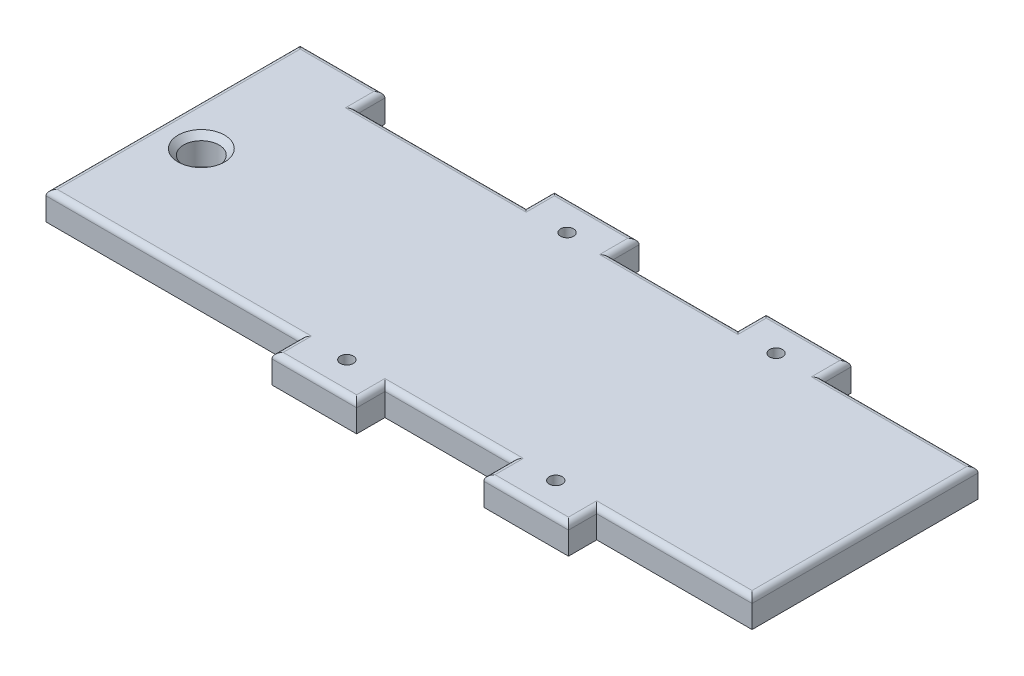
from build123d import *

# Parameters (mm, degrees)
SKETCH1_W           = 260
SKETCH1_H           = 100
BOSS_EXTRUDE1_DEPTH = 10
SKETCH3_W           = 55
SKETCH3_H           = 10
SKETCH3_W_2         = 60
SKETCH3_W_3         = 45
CUT_EXTRUDE2_DEPTH  = 140.642400438
FILLET1_R           = 2
SKETCH2_R           = 6.25
CUT_EXTRUDE1_DEPTH  = 140.642400438
CHAMFER1_SIZE       = 2
SKETCH4_R           = 2.3
CUT_EXTRUDE3_DEPTH  = 6.2


with BuildPart() as part:
    # Sketch1 → Boss-Extrude1 (new body)
    with BuildSketch(Plane(origin=(0, 0, 0), x_dir=(1, 0, 0), z_dir=(0, 1, 0))):
        Rectangle(SKETCH1_W, SKETCH1_H)
    extrude(amount=BOSS_EXTRUDE1_DEPTH)

    # Sketch3 → Cut-Extrude2 (cut, through all)
    with BuildSketch(Plane(origin=(0, 10, 0), x_dir=(1, 0, 0), z_dir=(0, 1, 0))):
        with Locations((102.5, 45)):
            Rectangle(SKETCH3_W, SKETCH3_H)
        with Locations((102.5, -45)):
            Rectangle(SKETCH3_W, SKETCH3_H)
        Polygon((-130, -50), (-30, -50), (-30, -40), (-120, -40), (-120, 50), (-130, 50), (-130, -40), align=None)
        with Locations((-60, 45)):
            Rectangle(SKETCH3_W_2, SKETCH3_H)
        with Locations((22.5, 45)):
            Rectangle(SKETCH3_W_3, SKETCH3_H)
        with Locations((22.5, -45)):
            Rectangle(SKETCH3_W_3, SKETCH3_H)
    extrude(amount=-CUT_EXTRUDE2_DEPTH, mode=Mode.SUBTRACT)

    # Fillet1
    fillet1_edges = [part.edges().sort_by_distance(p)[0] for p in [
        (130, 10, 0),
        (-60, 10, -40),
        (-30, 10, -45),
        (-15, 10, -50),
        (60, 10, -50),
        (75, 10, -45),
        (102.5, 10, -40),
        (102.5, 10, 40),
        (75, 10, 45),
        (-30, 10, 45),
        (-75, 10, 40),
        (-90, 10, -45),
        (60, 10, 50),
        (45, 10, 45),
        (22.5, 10, 40),
        (0, 10, 45),
        (-15, 10, 50),
        (0, 10, -45),
        (22.5, 10, -40),
        (45, 10, -45),
        (-120, 10, -5),
        (-105, 10, -50),
    ]]
    fillet(fillet1_edges, radius=FILLET1_R)

    # Sketch2 → Cut-Extrude1 (cut, through all)
    with BuildSketch(Plane(origin=(0, 10, 0), x_dir=(1, 0, 0), z_dir=(0, 1, 0))):
        with Locations((-105, 0)):
            Circle(SKETCH2_R)
    extrude(amount=-CUT_EXTRUDE1_DEPTH, mode=Mode.SUBTRACT)

    # Chamfer1
    chamfer1_edges = [part.edges().sort_by_distance(p)[0] for p in [
        (-111.25, 10, 0),
    ]]
    chamfer(chamfer1_edges, length=CHAMFER1_SIZE)

    # Sketch4 → Cut-Extrude3 (cut)
    with BuildSketch(Plane(origin=(0, 10, 0), x_dir=(1, 0, 0), z_dir=(0, 1, 0))):
        with Locations((59.5, 39)):
            Circle(SKETCH4_R)
        with Locations((-14.5, 39)):
            Circle(SKETCH4_R)
        with Locations((59.5, -39)):
            Circle(SKETCH4_R)
        with Locations((-14.5, -39)):
            Circle(SKETCH4_R)
    extrude(amount=-CUT_EXTRUDE3_DEPTH, mode=Mode.SUBTRACT)


solid = part.part
